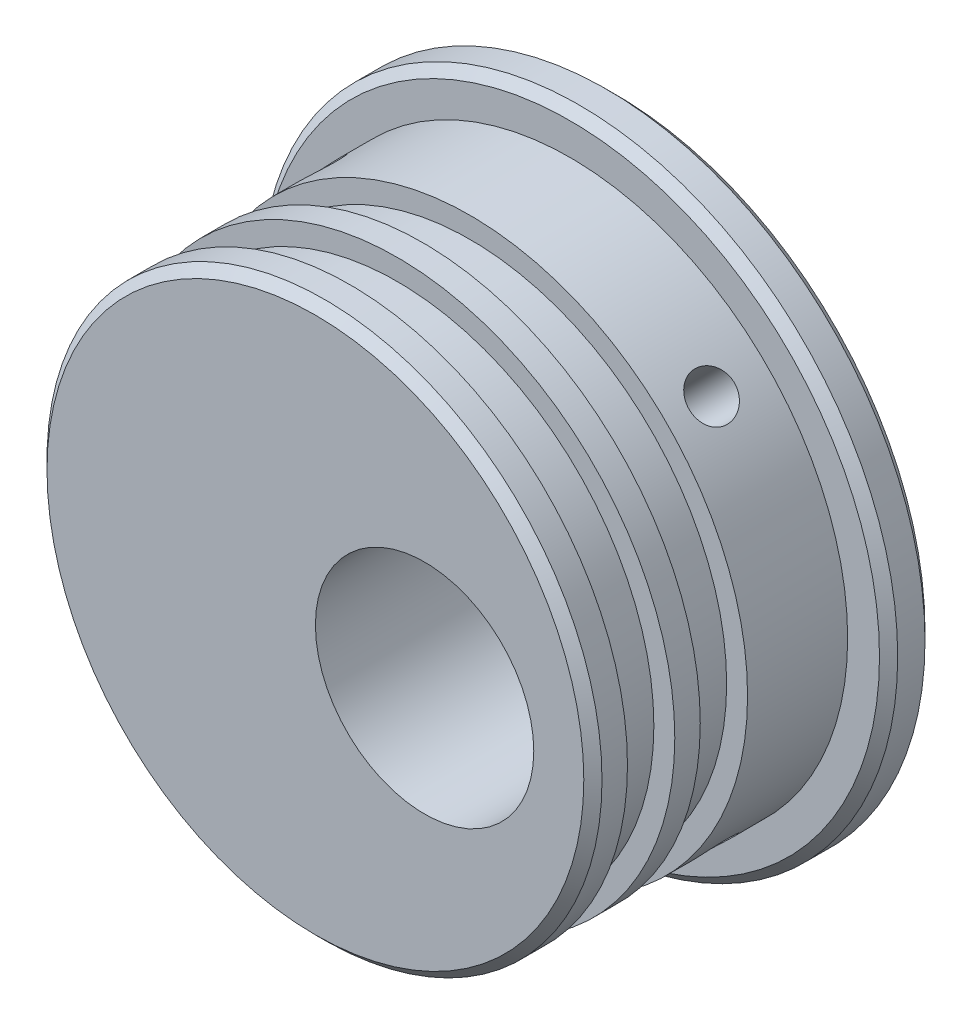
from build123d import *

# Parameters (mm, degrees)
SKETCH_1_R               = 17.5
EXTRUDE_1_DEPTH          = 2.5
SKETCH_1_3_R             = 15.25
EXTRUDE_2_DEPTH          = 14
CUT_EXTRUDE_START        = 5.5
SKETCH_1_4_R             = 15.25
SKETCH_1_4_R_2           = 14.1
CUT_EXTRUDE_1_DEPTH      = 2.6
CUT_EXTRUDE_START_2      = 9.5
SKETCH_1_5_R             = 15.25
SKETCH_1_5_R_2           = 14.1
CUT_EXTRUDE_2_DEPTH      = 2.6
CHAMFER_1_SIZE           = 0.5
SKETCH_2_R               = 6
CUT_EXTRUDE_5_DEPTH      = 30.744747435
CUT_EXTRUDE_START_3      = 10
SKETCH_4_R               = 1.25
CUT_EXTRUDE_6_DEPTH      = 19.434134416
PATTERN_CIRCULAR_1_COUNT = 4


with BuildPart() as part:
    # Эскиз1 → Бобышка-Вытянуть1 (new body)
    with BuildSketch(Plane.XY):
        Circle(SKETCH_1_R)
    extrude(amount=-EXTRUDE_1_DEPTH)

    # Эскиз1<3> → Бобышка-Вытянуть2 (add)
    with BuildSketch(Plane.XY):
        Circle(SKETCH_1_3_R)
    extrude(amount=EXTRUDE_2_DEPTH)

    # Эскиз1<4> → Вырез-Вытянуть1 (cut)
    with BuildSketch(Plane.XY.offset(CUT_EXTRUDE_START)):
        Circle(SKETCH_1_4_R)
        Circle(SKETCH_1_4_R_2, mode=Mode.SUBTRACT)
    extrude(amount=CUT_EXTRUDE_1_DEPTH, mode=Mode.SUBTRACT)

    # Эскиз1<5> → Вырез-Вытянуть2 (cut)
    with BuildSketch(Plane.XY.offset(CUT_EXTRUDE_START_2)):
        Circle(SKETCH_1_5_R)
        Circle(SKETCH_1_5_R_2, mode=Mode.SUBTRACT)
    extrude(amount=CUT_EXTRUDE_2_DEPTH, mode=Mode.SUBTRACT)

    # Фаска1
    chamfer_1_edges = [part.edges().sort_by_distance(p)[0] for p in [
        (-15.25, 0, 14),
        (-17.5, 0, 0),
        (-17.5, 0, -2.5),
    ]]
    chamfer(chamfer_1_edges, length=CHAMFER_1_SIZE)

    # Эскиз2 → Вырез-Вытянуть5 (cut, through all)
    with BuildSketch(Plane(origin=(0, 0, -2.5), x_dir=(-1, 0, 0), z_dir=(0, 0, -1))):
        with Locations((-6, 0)):
            Circle(SKETCH_2_R)
    extrude(amount=-CUT_EXTRUDE_5_DEPTH, mode=Mode.SUBTRACT)

    # Эскиз4 → Вырез-Вытянуть6 (cut, through all)
    with BuildSketch(Plane(origin=(0, 0, 0), x_dir=(0, 0, -1), z_dir=(0.7071067811865488, 0.7071067811865464, 0)).offset(CUT_EXTRUDE_START_3)):
        with Locations((-3, 0)):
            Circle(SKETCH_4_R)
    cut_extrude_6 = extrude(amount=CUT_EXTRUDE_6_DEPTH, mode=Mode.SUBTRACT)

    # Круговой массив1: Вырез-Вытянуть6 ×4 about axis
    pattern_circular_1_axis = Axis((0, 0, 0), (0, 0, -1))
    for i in range(1, PATTERN_CIRCULAR_1_COUNT):
        add(cut_extrude_6.rotate(pattern_circular_1_axis, i * 360 / PATTERN_CIRCULAR_1_COUNT), mode=Mode.SUBTRACT)


solid = part.part
